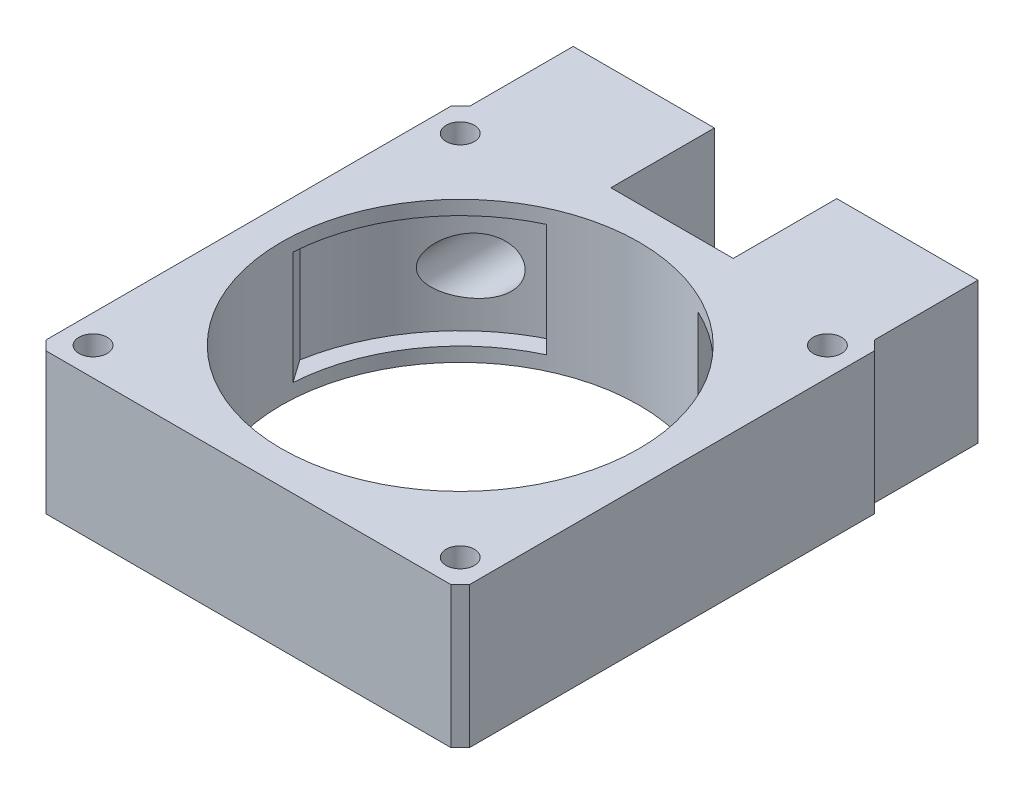
from build123d import *

# Parameters (mm, degrees)
SKETCH_1_W               = 45
SKETCH_1_H               = 45
EXTRUDE_1_DEPTH          = 15
SKETCH_2_R               = 19
CUT_EXTRUDE_1_DEPTH      = 36.178118199
SKETCH_5_W               = 15
SKETCH_5_H               = 15
EXTRUDE_2_DEPTH          = 12
SKETCH_6_R               = 3
CUT_EXTRUDE_4_DEPTH      = 35
SKETCH_7_R               = 1.5
CUT_EXTRUDE_5_DEPTH      = 44.834917702
CUT_EXTRUDE_6_DEPTH      = 6
CUT_EXTRUDE_6_DEPTH_BACK = 6
SKETCH_9_R               = 4.25
CUT_EXTRUDE_7_DEPTH      = 12
CHAMFER_1_SIZE           = 2
CHAMFER_2_SIZE           = 1
CHAMFER_3_SIZE           = 1
CHAMFER_4_SIZE           = 1


# Some blends are built 0.0001 mm under size
with BuildPart() as part:
    # 草图1 → 凸台-拉伸1 (new body)
    with BuildSketch(Plane(origin=(0, 0, 0), x_dir=(1, 0, 0), z_dir=(0, 1, 0))):
        Rectangle(SKETCH_1_W, SKETCH_1_H)
    extrude(amount=EXTRUDE_1_DEPTH)

    # 草图2 → 切除-拉伸1 (cut, through all)
    with BuildSketch(Plane(origin=(0, 15, 0), x_dir=(1, 0, 0), z_dir=(0, 1, 0))):
        with Locations(Location((0, 0, 0), (0, 0, 270))):
            Circle(SKETCH_2_R)
    extrude(amount=-CUT_EXTRUDE_1_DEPTH, mode=Mode.SUBTRACT)

    # 草图5 → 凸台-拉伸2 (add)
    with BuildSketch(Plane(origin=(0, 0, -22.5), x_dir=(-1, 0, 0), z_dir=(0, 0, -1))):
        with Locations((14, 7.5)):
            Rectangle(SKETCH_5_W, SKETCH_5_H)
        with Locations((-14, 7.5)):
            Rectangle(SKETCH_5_W, SKETCH_5_H)
    extrude(amount=EXTRUDE_2_DEPTH)

    # 草图6 → 切除-拉伸4 (cut)
    with BuildSketch(Plane(origin=(0, 0, -34.5), x_dir=(-1, 0, 0), z_dir=(0, 0, -1))):
        with Locations((-14, 7.5)):
            Circle(SKETCH_6_R)
        with Locations((14, 7.5)):
            Circle(SKETCH_6_R)
    extrude(amount=-CUT_EXTRUDE_4_DEPTH, mode=Mode.SUBTRACT)

    # 草图7 → 切除-拉伸5 (cut, through all)
    with BuildSketch(Plane(origin=(0, 15, 0), x_dir=(1, 0, 0), z_dir=(0, 1, 0))):
        with Locations(Location((-19.5, 19.5, 0), (0, 0, 270))):
            Circle(SKETCH_7_R)
        with Locations(Location((19.5, 19.5, 0), (0, 0, 90))):
            Circle(SKETCH_7_R)
        with Locations(Location((19.5, -19.5, 0), (0, 0, 270))):
            Circle(SKETCH_7_R)
        with Locations(Location((-19.5, -19.5, 0), (0, 0, 90))):
            Circle(SKETCH_7_R)
    extrude(amount=-CUT_EXTRUDE_5_DEPTH, mode=Mode.SUBTRACT)

    # 草图8 → 切除-拉伸6 (cut, two sides: drawn at the far end of the back side and taken through both)
    with BuildSketch(Plane(origin=(0, 7.5, 0), x_dir=(-1, 0, 0), z_dir=(0, -1, 0)).offset(-CUT_EXTRUDE_6_DEPTH_BACK)):
        with BuildLine():
            Line((-8.874983497, 19.032463528), (-8.029746973, 17.219847954))
            ThreePointArc((-8.029746973, 17.219847954), (-15.073713466, 11.566467151), (-18.711347307, 3.299315376))
            Line((-18.711347307, 3.299315376), (-20.680962813, 3.646611731))
            ThreePointArc((-20.680962813, 3.646611731), (-16.660420146, 12.783990009), (-8.874983497, 19.032463528))
        make_face()
        with BuildLine():
            Line((20.680962813, 3.646611731), (18.711347307, 3.299315376))
            ThreePointArc((18.711347307, 3.299315376), (15.073713466, 11.566467151), (8.029746973, 17.219847954))
            Line((8.029746973, 17.219847954), (8.874983497, 19.032463528))
            ThreePointArc((8.874983497, 19.032463528), (16.660420146, 12.783990009), (20.680962813, 3.646611731))
        make_face()
    extrude(amount=CUT_EXTRUDE_6_DEPTH + CUT_EXTRUDE_6_DEPTH_BACK, mode=Mode.SUBTRACT)

    # 草图9 → 切除-拉伸7 (cut)
    with BuildSketch(Plane(origin=(0, 0, -34.5), x_dir=(-1, 0, 0), z_dir=(0, 0, -1))):
        with Locations((-14, 7.5)):
            Circle(SKETCH_9_R)
        with Locations((14, 7.5)):
            Circle(SKETCH_9_R)
    extrude(amount=-CUT_EXTRUDE_7_DEPTH, mode=Mode.SUBTRACT)

    # 倒角1
    # the kernel refuses this chamfer: 2 mm, written as the material it takes off along each edge
    with BuildSketch(Plane(origin=(-18.711347307, 1.5, -3.299315376), x_dir=(-0.11838916494267775, 0, 0.9929672731888879), z_dir=(0, 1, 0)), Plane(origin=(18.711347307, 13.5, -3.299315376), x_dir=(0.11838916494267755, 0, 0.9929672731888879), z_dir=(0, -1, 0))) as chamfer_1_piece_1:
        with BuildLine():
            Line((2.121782819, 0), (-CHAMFER_1_SIZE * 0.055836389964, -CHAMFER_1_SIZE * 0.998439931872))
            Line((-CHAMFER_1_SIZE * 0.055836389964, -CHAMFER_1_SIZE * 0.998439931872), (0, 0))
            ThreePointArc((0, 0), (1.090799435, -0.029617755), (2.121782819, 0))
        make_face()
    extrude(amount=12, mode=Mode.SUBTRACT)

    # 倒角2
    chamfer_2_edges = [part.edges().sort_by_distance(p)[0] for p in [
        (22.5, 7.5, 22.5),
        (-22.5, 7.5, 22.5),
        (-22.5, 7.5, -22.5),
        (22.5, 7.5, -22.5),
    ]]
    chamfer(chamfer_2_edges, length=CHAMFER_2_SIZE - 0.0001)  # a hair under: the kernel refuses the full size

    # 倒角3
    chamfer_3_edges = [part.edges().sort_by_distance(p)[0] for p in [
        (18.25, 7.5, -22.5),
        (-9.75, 7.5, -22.5),
    ]]
    chamfer(chamfer_3_edges, length=CHAMFER_3_SIZE)

    # 倒角4
    chamfer_4_edges = [part.edges().sort_by_distance(p)[0] for p in [
        (6.5, 7.5, -34.5),
        (14, 15, -34.5),
        (21.5, 7.5, -34.5),
        (14, 0, -34.5),
        (-21.5, 7.5, -34.5),
        (-14, 15, -34.5),
        (-6.5, 7.5, -34.5),
        (-14, 0, -34.5),
    ]]
    chamfer(chamfer_4_edges, length=CHAMFER_4_SIZE)


solid = part.part
